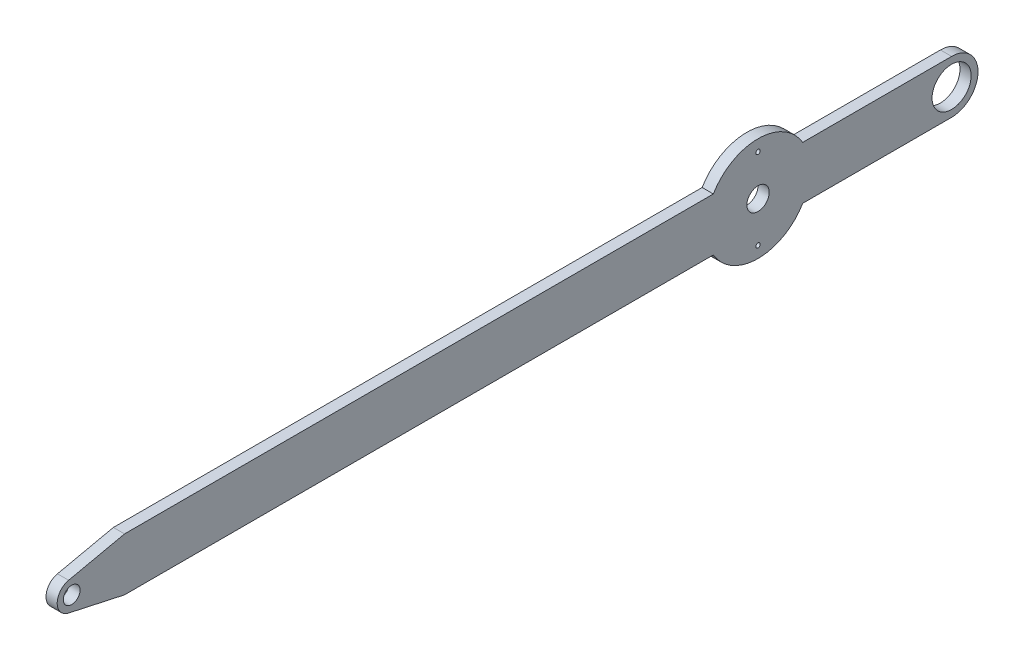
from build123d import *

# Parameters (mm, degrees)
SKETCH1_R             = 4.7625
SKETCH1_R_2           = 6.35
SKETCH1_R_3           = 11.1125
BOSS_EXTRUDE1_DEPTH   = 3.175
M3X0_5_TAPPED_HOLE1_D = 2.5


with BuildPart() as part:
    # Sketch1 → Boss-Extrude1 (new, symmetric)
    with BuildSketch(Plane(origin=(0, 0, 0), x_dir=(0, 0, -1), z_dir=(1, 0, 0))):
        with BuildLine():
            Line((-135.401771592, 15), (-470, 15))
            Line((-470, 15), (-501.760727799, 8.072716015))
            ThreePointArc((-501.760727799, 8.072716015), (-508.2625, 0), (-501.760727799, -8.072716015))
            Line((-501.760727799, -8.072716015), (-470, -15))
            Line((-470, -15), (-135.401771592, -15))
            ThreePointArc((-135.401771592, -15), (-110, -29.5), (-84.598228408, -15))
            Line((-84.598228408, -15), (0, -15))
            ThreePointArc((0, -15), (15, 0), (0, 15))
            Line((0, 15), (-84.598228408, 15))
            ThreePointArc((-84.598228408, 15), (-110, 29.5), (-135.401771592, 15))
        make_face()
        with Locations((-500, 0)):
            Circle(SKETCH1_R, mode=Mode.SUBTRACT)
        with Locations((-110, 0)):
            Circle(SKETCH1_R_2, mode=Mode.SUBTRACT)
        Circle(SKETCH1_R_3, mode=Mode.SUBTRACT)
    extrude(amount=BOSS_EXTRUDE1_DEPTH, both=True)

    # M3x0.5 Tapped Hole1 (through all)
    with Locations(Plane(origin=(3.175, 0, 0), x_dir=(0, 0, -1), z_dir=(1, 0, 0))):
        with Locations((-110, 23.015), (-110, 0), (-110, -23.015)):
            Hole(M3X0_5_TAPPED_HOLE1_D / 2)


solid = part.part
